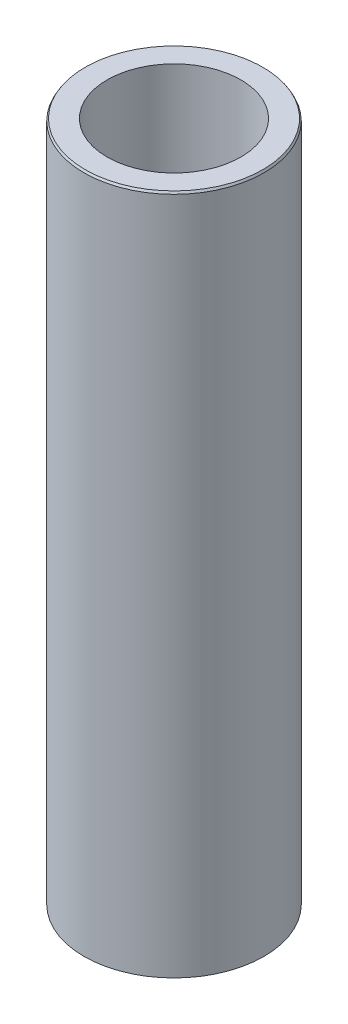
from build123d import *
from OCP.BRepFilletAPI import BRepFilletAPI_MakeChamfer

# Parameters (mm, degrees)
SKETCH1_R           = 37.5
BOSS_EXTRUDE1_DEPTH = 284.130501415
SKETCH2_R           = 27.869931365
CUT_EXTRUDE1_DEPTH  = 290.037440195
CHAMFER1_SIZE       = 0.871001799
CHAMFER1_SIZE2      = 0.502873123


with BuildPart() as part:
    # Sketch1 → Boss-Extrude1 (new body)
    with BuildSketch(Plane(origin=(0, 0, 0), x_dir=(1, 0, 0), z_dir=(0, 1, 0))):
        Circle(SKETCH1_R)
    extrude(amount=BOSS_EXTRUDE1_DEPTH)

    # Sketch2 → Cut-Extrude1 (cut, through all)
    with BuildSketch(Plane(origin=(0, 0, 0), x_dir=(1, 0, 0), z_dir=(0, 1, 0))):
        Circle(SKETCH2_R)
    extrude(amount=CUT_EXTRUDE1_DEPTH, mode=Mode.SUBTRACT)

    # Chamfer1: one chamfer whose edges measure the first distance from different faces: ONE call of the kernel's chamfer builder (chamfer() names one face for all edges)
    chamfer1_edges_1 = [part.edges().sort_by_distance(p)[0] for p in [
        (-37.5, 284.130501415, 0),
    ]]
    chamfer1_side_1 = [part.faces().sort_by_distance(p)[0] for p in [
        (-37.5, 142.065250708, 0),
    ]]
    chamfer1_edges_2 = [part.edges().sort_by_distance(p)[0] for p in [
        (-37.5, 0, 0),
    ]]
    chamfer1_side_2 = [part.faces().sort_by_distance(p)[0] for p in [
        (-36.439339828, 0, 0),
    ]]
    chamfer1 = BRepFilletAPI_MakeChamfer(part.part.solid().wrapped)
    for e in chamfer1_edges_1:
        chamfer1.Add(CHAMFER1_SIZE, CHAMFER1_SIZE2, e.wrapped, chamfer1_side_1[0].wrapped)  # the first distance lies on this face
    for e in chamfer1_edges_2:
        chamfer1.Add(CHAMFER1_SIZE, CHAMFER1_SIZE2, e.wrapped, chamfer1_side_2[0].wrapped)  # the first distance lies on this face
    add(Compound.cast(chamfer1.Shape()), mode=Mode.REPLACE)


solid = part.part
